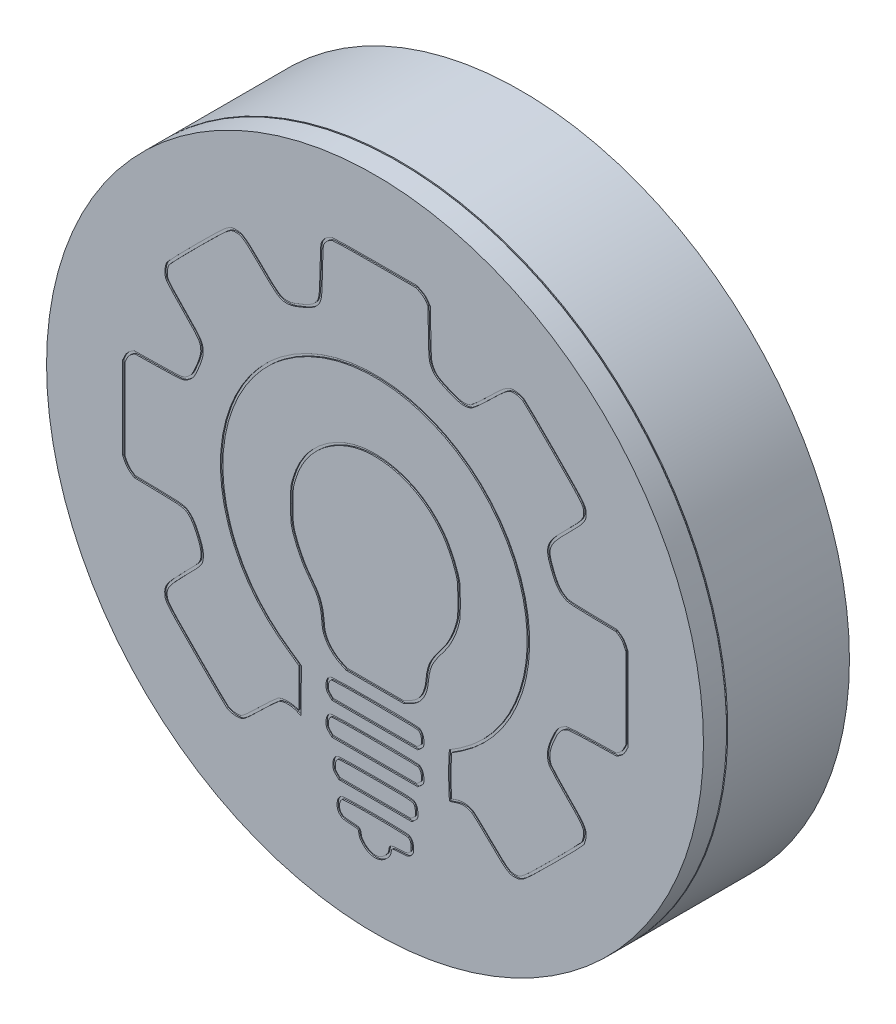
from build123d import *

# Parameters (mm, degrees)
SKETCH1_R           = 27
SKETCH1_R_2         = 25.025
BOSS_EXTRUDE1_DEPTH = 10
SKETCH2_R           = 27
BOSS_EXTRUDE3_DEPTH = 2
CUT_EXTRUDE1_DEPTH  = 0.1
CUT_EXTRUDE2_START  = -10
SKETCH5_R           = 27
SKETCH5_R_2         = 26.9
CUT_EXTRUDE2_DEPTH  = 0.1


with BuildPart() as part:
    # Sketch1 → Boss-Extrude1 (new body)
    with BuildSketch(Plane.XY):
        Circle(SKETCH1_R)
        Circle(SKETCH1_R_2, mode=Mode.SUBTRACT)
    extrude(amount=BOSS_EXTRUDE1_DEPTH)

    # Sketch2 → Boss-Extrude3 (add)
    with BuildSketch(Plane.XY.offset(10)):
        Circle(SKETCH2_R)
    extrude(amount=BOSS_EXTRUDE3_DEPTH)

    # Sketch4 → Cut-Extrude1 (cut)
    # profile 1 of 6: a face of its own
    with BuildSketch(Plane.XY.offset(12)):
        with BuildLine():
            Line((-17.8576224, 4.620282801), (-19.804957, 4.585005001))
            Line((-19.804957, 4.585005001), (-20.1012904, 4.387449401))
            add(Edge.make_bspline(
                [(-20.1012904, 4.387449401), (-20.3059016, 4.246338201), (-20.4540684, 4.077004601), (-20.574013, 3.823004601)],
                knots=[0, 0, 0, 0, 1, 1, 1, 1], degree=3))
            Line((-20.574013, 3.823004601), (-20.7433464, 3.456115401))
            Line((-20.7433464, 3.456115401), (-20.7433464, 0.062391001))
            Line((-20.7433464, 0.062391001), (-20.7433464, -3.324277799))
            Line((-20.7433464, -3.324277799), (-20.5669574, -3.684111399))
            add(Edge.make_bspline(
                [(-20.5669574, -3.684111399), (-20.4540684, -3.909889199), (-20.2776794, -4.121555999), (-20.0942348, -4.241500599)],
                knots=[0, 0, 0, 0, 1, 1, 1, 1], degree=3))
            Line((-20.0942348, -4.241500599), (-19.804957, -4.446111799))
            Line((-19.804957, -4.446111799), (-17.8576224, -4.481389599))
            add(Edge.make_bspline(
                [(-17.8576224, -4.481389599), (-15.6562876, -4.523722999), (-15.585732, -4.537833999), (-15.1412318, -5.052889999)],
                knots=[0, 0, 0, 0, 1, 1, 1, 1], degree=3))
            add(Edge.make_bspline(
                [(-15.1412318, -5.052889999), (-14.8590094, -5.384501199), (-14.4215646, -6.344057399), (-14.3298424, -6.859113399)],
                knots=[0, 0, 0, 0, 1, 1, 1, 1], degree=3))
            add(Edge.make_bspline(
                [(-14.3298424, -6.859113399), (-14.2945646, -7.035502399), (-14.3016202, -7.303613599), (-14.336898, -7.501169199)],
                knots=[0, 0, 0, 0, 1, 1, 1, 1], degree=3))
            add(Edge.make_bspline(
                [(-14.336898, -7.501169199), (-14.4074536, -7.804558399), (-14.513287, -7.938613999), (-15.7056766, -9.138059199)],
                knots=[0, 0, 0, 0, 1, 1, 1, 1], degree=3))
            add(Edge.make_bspline(
                [(-15.7056766, -9.138059199), (-17.0391774, -10.485671199), (-17.2790664, -10.824337999), (-17.286122, -11.318227199)],
                knots=[0, 0, 0, 0, 1, 1, 1, 1], degree=3))
            add(Edge.make_bspline(
                [(-17.286122, -11.318227199), (-17.286122, -11.960283199), (-17.2578998, -11.995560999), (-14.753176, -14.521451399)],
                knots=[0, 0, 0, 0, 1, 1, 1, 1], degree=3))
            add(Edge.make_bspline(
                [(-14.753176, -14.521451399), (-13.4478974, -15.833785599), (-12.28373, -16.969730799), (-12.1567298, -17.047341999)],
                knots=[0, 0, 0, 0, 1, 1, 1, 1], degree=3))
            add(Edge.make_bspline(
                [(-12.1567298, -17.047341999), (-11.8603964, -17.230786599), (-11.3100626, -17.294286599), (-10.9643402, -17.181397599)],
                knots=[0, 0, 0, 0, 1, 1, 1, 1], degree=3))
            add(Edge.make_bspline(
                [(-10.9643402, -17.181397599), (-10.759729, -17.117897599), (-10.357562, -16.765119599), (-9.3838948, -15.805563399)],
                knots=[0, 0, 0, 0, 1, 1, 1, 1], degree=3))
            add(Edge.make_bspline(
                [(-9.3838948, -15.805563399), (-8.6642276, -15.100007399), (-7.9657272, -14.457951399), (-7.8316716, -14.387395799)],
                knots=[0, 0, 0, 0, 1, 1, 1, 1], degree=3))
            add(Edge.make_bspline(
                [(-7.8316716, -14.387395799), (-7.4859492, -14.203951199), (-6.829782, -14.218062399), (-6.399393, -14.408562599)],
                knots=[0, 0, 0, 0, 1, 1, 1, 1], degree=3))
            Line((-6.399393, -14.408562599), (-6.0677816, -14.563784799))
            Line((-6.0677816, -14.563784799), (-6.0677816, -12.799894799))
            add(Edge.make_bspline(
                [(-6.0677816, -12.799894799), (-6.0677816, -11.833283199), (-6.060726, -11.021893799), (-6.0536704, -10.986615999)],
                knots=[0, 0, 0, 0, 1, 1, 1, 1], degree=3))
            add(Edge.make_bspline(
                [(-6.0536704, -10.986615999), (-6.0536704, -10.958393599), (-6.413504, -10.690282399), (-6.8650598, -10.386893399)],
                knots=[0, 0, 0, 0, 1, 1, 1, 1], degree=3))
            add(Edge.make_bspline(
                [(-6.8650598, -10.386893399), (-9.3133392, -8.750003399), (-10.9784514, -6.576890999), (-11.881563, -3.839333599)],
                knots=[0, 0, 0, 0, 1, 1, 1, 1], degree=3))
            add(Edge.make_bspline(
                [(-11.881563, -3.839333599), (-13.5607864, 1.219502801), (-11.7968964, 6.863950801), (-7.5423936, 10.067175201)],
                knots=[0, 0, 0, 0, 1, 1, 1, 1], degree=3))
            add(Edge.make_bspline(
                [(-7.5423936, 10.067175201), (-3.3796132, 13.192788201), (2.2366126, 13.432677201), (6.6675042, 10.666897801)],
                knots=[0, 0, 0, 0, 1, 1, 1, 1], degree=3))
            add(Edge.make_bspline(
                [(6.6675042, 10.666897801), (11.5005628, 7.654173601), (13.6807308, 1.621669801), (11.8886186, -3.811111399)],
                knots=[0, 0, 0, 0, 1, 1, 1, 1], degree=3))
            add(Edge.make_bspline(
                [(11.8886186, -3.811111399), (11.0066736, -6.506335399), (9.299228, -8.757058999), (6.942671, -10.337504399)],
                knots=[0, 0, 0, 0, 1, 1, 1, 1], degree=3))
            add(Edge.make_bspline(
                [(6.942671, -10.337504399), (6.5475596, -10.598560199), (6.1947816, -10.824337999), (6.1453928, -10.838449199)],
                knots=[0, 0, 0, 0, 1, 1, 1, 1], degree=3))
            add(Edge.make_bspline(
                [(6.1453928, -10.838449199), (6.0183926, -10.880782599), (6.0254482, -14.542618199), (6.1524484, -14.521451399)],
                knots=[0, 0, 0, 0, 1, 1, 1, 1], degree=3))
            add(Edge.make_bspline(
                [(6.1524484, -14.521451399), (6.2018372, -14.514395999), (6.4346708, -14.436784799), (6.6675042, -14.359173599)],
                knots=[0, 0, 0, 0, 1, 1, 1, 1], degree=3))
            add(Edge.make_bspline(
                [(6.6675042, -14.359173599), (7.1261156, -14.189840199), (7.5423936, -14.211006799), (7.937505, -14.408562599)],
                knots=[0, 0, 0, 0, 1, 1, 1, 1], degree=3))
            add(Edge.make_bspline(
                [(7.937505, -14.408562599), (8.050394, -14.472062599), (8.7206722, -15.085896199), (9.4191726, -15.777341199)],
                knots=[0, 0, 0, 0, 1, 1, 1, 1], degree=3))
            add(Edge.make_bspline(
                [(9.4191726, -15.777341199), (10.7032846, -17.047341999), (10.985507, -17.251953199), (11.4370628, -17.251953199)],
                knots=[0, 0, 0, 0, 1, 1, 1, 1], degree=3))
            add(Edge.make_bspline(
                [(11.4370628, -17.251953199), (12.0650076, -17.251953199), (12.1143966, -17.216675399), (14.6261758, -14.719007199)],
                knots=[0, 0, 0, 0, 1, 1, 1, 1], degree=3))
            add(Edge.make_bspline(
                [(14.6261758, -14.719007199), (15.93851, -13.413728599), (17.0744552, -12.249561199), (17.1520664, -12.122560999)],
                knots=[0, 0, 0, 0, 1, 1, 1, 1], degree=3))
            add(Edge.make_bspline(
                [(17.1520664, -12.122560999), (17.2296776, -12.002616599), (17.3072886, -11.741560799), (17.335511, -11.544005199)],
                knots=[0, 0, 0, 0, 1, 1, 1, 1], degree=3))
            add(Edge.make_bspline(
                [(17.335511, -11.544005199), (17.413122, -10.887837999), (17.2720108, -10.676171199), (15.8538434, -9.250948199)],
                knots=[0, 0, 0, 0, 1, 1, 1, 1], degree=3))
            add(Edge.make_bspline(
                [(15.8538434, -9.250948199), (15.105954, -8.503058799), (14.5415092, -7.875113999), (14.4780092, -7.734002799)],
                knots=[0, 0, 0, 0, 1, 1, 1, 1], degree=3))
            add(Edge.make_bspline(
                [(14.4780092, -7.734002799), (14.2945646, -7.296557999), (14.3439534, -6.845002199), (14.640287, -6.104168399)],
                knots=[0, 0, 0, 0, 1, 1, 1, 1], degree=3))
            add(Edge.make_bspline(
                [(14.640287, -6.104168399), (15.0353984, -5.130501199), (15.2470652, -4.855334199), (15.8044544, -4.608389599)],
                knots=[0, 0, 0, 0, 1, 1, 1, 1], degree=3))
            add(Edge.make_bspline(
                [(15.8044544, -4.608389599), (15.9102878, -4.559000799), (16.7287328, -4.509611799), (17.928178, -4.488445199)],
                knots=[0, 0, 0, 0, 1, 1, 1, 1], degree=3))
            Line((17.928178, -4.488445199), (19.8755126, -4.446111799))
            Line((19.8755126, -4.446111799), (20.157735, -4.255611599))
            add(Edge.make_bspline(
                [(20.157735, -4.255611599), (20.3411794, -4.135667199), (20.510513, -3.938111399), (20.6304574, -3.698222399)],
                knots=[0, 0, 0, 0, 1, 1, 1, 1], degree=3))
            Line((20.6304574, -3.698222399), (20.813902, -3.324277799))
            Line((20.813902, -3.324277799), (20.813902, 0.062391001))
            Line((20.813902, 0.062391001), (20.813902, 3.456115401))
            Line((20.813902, 3.456115401), (20.6445686, 3.823004601))
            add(Edge.make_bspline(
                [(20.6445686, 3.823004601), (20.524624, 4.077004601), (20.3764572, 4.246338201), (20.171846, 4.387449401)],
                knots=[0, 0, 0, 0, 1, 1, 1, 1], degree=3))
            Line((20.171846, 4.387449401), (19.8755126, 4.585005001))
            Line((19.8755126, 4.585005001), (17.928178, 4.620282801))
            add(Edge.make_bspline(
                [(17.928178, 4.620282801), (16.0937324, 4.655560601), (15.9667322, 4.669671801), (15.6845098, 4.810783001)],
                knots=[0, 0, 0, 0, 1, 1, 1, 1], degree=3))
            add(Edge.make_bspline(
                [(15.6845098, 4.810783001), (15.2611762, 5.036560801), (15.0142316, 5.382283201), (14.6826204, 6.207783801)],
                knots=[0, 0, 0, 0, 1, 1, 1, 1], degree=3))
            add(Edge.make_bspline(
                [(14.6826204, 6.207783801), (14.1393422, 7.576562401), (14.2310646, 7.830562601), (15.9102878, 9.488619201)],
                knots=[0, 0, 0, 0, 1, 1, 1, 1], degree=3))
            add(Edge.make_bspline(
                [(15.9102878, 9.488619201), (17.1167886, 10.681008801), (17.349622, 10.998509001), (17.3566776, 11.457120401)],
                knots=[0, 0, 0, 0, 1, 1, 1, 1], degree=3))
            add(Edge.make_bspline(
                [(17.3566776, 11.457120401), (17.3566776, 12.099176401), (17.3284554, 12.134454201), (14.8237316, 14.660344601)],
                knots=[0, 0, 0, 0, 1, 1, 1, 1], degree=3))
            add(Edge.make_bspline(
                [(14.8237316, 14.660344601), (13.518453, 15.972678801), (12.3542856, 17.108624001), (12.2272854, 17.186235201)],
                knots=[0, 0, 0, 0, 1, 1, 1, 1], degree=3))
            add(Edge.make_bspline(
                [(12.2272854, 17.186235201), (12.107341, 17.263846401), (11.8462852, 17.341457401), (11.6487296, 17.369679801)],
                knots=[0, 0, 0, 0, 1, 1, 1, 1], degree=3))
            add(Edge.make_bspline(
                [(11.6487296, 17.369679801), (10.9925624, 17.447290801), (10.7667846, 17.306179601), (9.348617, 15.902123201)],
                knots=[0, 0, 0, 0, 1, 1, 1, 1], degree=3))
            add(Edge.make_bspline(
                [(9.348617, 15.902123201), (8.5725054, 15.140122801), (7.9727828, 14.603900201), (7.810505, 14.533344601)],
                knots=[0, 0, 0, 0, 1, 1, 1, 1], degree=3))
            add(Edge.make_bspline(
                [(7.810505, 14.533344601), (7.3801158, 14.356955601), (7.0202822, 14.399289001), (6.1806706, 14.745011401)],
                knots=[0, 0, 0, 0, 1, 1, 1, 1], degree=3))
            add(Edge.make_bspline(
                [(6.1806706, 14.745011401), (5.2563922, 15.126011601), (5.002392, 15.302400601), (4.7907252, 15.746901001)],
                knots=[0, 0, 0, 0, 1, 1, 1, 1], degree=3))
            add(Edge.make_bspline(
                [(4.7907252, 15.746901001), (4.6284474, 16.071456601), (4.6213918, 16.170234601), (4.586114, 17.997624601)],
                knots=[0, 0, 0, 0, 1, 1, 1, 1], degree=3))
            Line((4.586114, 17.997624601), (4.5508362, 19.909681401))
            Line((4.5508362, 19.909681401), (4.360336, 20.191903801))
            add(Edge.make_bspline(
                [(4.360336, 20.191903801), (4.2403916, 20.375348201), (4.0428358, 20.544681801), (3.8029468, 20.664626201)],
                knots=[0, 0, 0, 0, 1, 1, 1, 1], degree=3))
            Line((3.8029468, 20.664626201), (3.4290022, 20.848070801))
            Line((3.4290022, 20.848070801), (0.0423334, 20.841015201))
            add(Edge.make_bspline(
                [(0.0423334, 20.841015201), (-2.166057, 20.841015201), (-3.4290022, 20.812793001), (-3.5630578, 20.763404001)],
                knots=[0, 0, 0, 0, 1, 1, 1, 1], degree=3))
            add(Edge.make_bspline(
                [(-3.5630578, 20.763404001), (-3.8876136, 20.643459601), (-4.1345582, 20.445903801), (-4.3180028, 20.156626001)],
                knots=[0, 0, 0, 0, 1, 1, 1, 1], degree=3))
            add(Edge.make_bspline(
                [(-4.3180028, 20.156626001), (-4.473225, 19.902625801), (-4.4802806, 19.825014601), (-4.5155584, 17.990569001)],
                knots=[0, 0, 0, 0, 1, 1, 1, 1], degree=3))
            add(Edge.make_bspline(
                [(-4.5155584, 17.990569001), (-4.5578918, 15.888012201), (-4.5790584, 15.782178801), (-5.0235588, 15.337678401)],
                knots=[0, 0, 0, 0, 1, 1, 1, 1], degree=3))
            add(Edge.make_bspline(
                [(-5.0235588, 15.337678401), (-5.3128366, 15.041345001), (-6.575782, 14.498066801), (-7.0767266, 14.441622401)],
                knots=[0, 0, 0, 0, 1, 1, 1, 1], degree=3))
            add(Edge.make_bspline(
                [(-7.0767266, 14.441622401), (-7.697616, 14.378122201), (-7.9163384, 14.526289001), (-9.285117, 15.888012201)],
                knots=[0, 0, 0, 0, 1, 1, 1, 1], degree=3))
            add(Edge.make_bspline(
                [(-9.285117, 15.888012201), (-10.5621734, 17.158013001), (-10.8796736, 17.383790801), (-11.3594516, 17.390846401)],
                knots=[0, 0, 0, 0, 1, 1, 1, 1], degree=3))
            add(Edge.make_bspline(
                [(-11.3594516, 17.390846401), (-12.0085632, 17.390846401), (-12.0297298, 17.376735201), (-14.5556202, 14.864956001)],
                knots=[0, 0, 0, 0, 1, 1, 1, 1], degree=3))
            add(Edge.make_bspline(
                [(-14.5556202, 14.864956001), (-15.8679544, 13.552621801), (-17.0038996, 12.388454401), (-17.0815108, 12.261454201)],
                knots=[0, 0, 0, 0, 1, 1, 1, 1], degree=3))
            add(Edge.make_bspline(
                [(-17.0815108, 12.261454201), (-17.2649554, 11.965120801), (-17.3284554, 11.414787001), (-17.2155664, 11.069064601)],
                knots=[0, 0, 0, 0, 1, 1, 1, 1], degree=3))
            add(Edge.make_bspline(
                [(-17.2155664, 11.069064601), (-17.1450108, 10.864453401), (-16.7851772, 10.448175401), (-15.7973988, 9.446285801)],
                knots=[0, 0, 0, 0, 1, 1, 1, 1], degree=3))
            add(Edge.make_bspline(
                [(-15.7973988, 9.446285801), (-14.3933424, 8.021062801), (-14.3227868, 7.915229401), (-14.3227868, 7.252006601)],
                knots=[0, 0, 0, 0, 1, 1, 1, 1], degree=3))
            add(Edge.make_bspline(
                [(-14.3227868, 7.252006601), (-14.3227868, 6.871006401), (-14.8378426, 5.565727801), (-15.1130096, 5.220005401)],
                knots=[0, 0, 0, 0, 1, 1, 1, 1], degree=3))
            add(Edge.make_bspline(
                [(-15.1130096, 5.220005401), (-15.232954, 5.085949801), (-15.458732, 4.895449601), (-15.6139542, 4.810783001)],
                knots=[0, 0, 0, 0, 1, 1, 1, 1], degree=3))
            add(Edge.make_bspline(
                [(-15.6139542, 4.810783001), (-15.8961766, 4.669671801), (-16.0231768, 4.655560601), (-17.8576224, 4.620282801)],
                knots=[0, 0, 0, 0, 1, 1, 1, 1], degree=3))
        make_face()
        with BuildLine():
            Line((-17.853999804, 4.420315488), (-19.742760988, 4.386098924))
            Line((-19.742760988, 4.386098924), (-19.988998471, 4.221940602))
            add(Edge.make_bspline(
                [(-19.988998471, 4.221940602), (-20.031944805, 4.192256832), (-20.116259085, 4.126719412), (-20.219217971, 4.020611115), (-20.309944432, 3.897840015), (-20.368230777, 3.790401494), (-20.393163313, 3.73760325)],
                knots=[0.002322855, 0.002322855, 0.002322855, 0.002322855, 0.251742141, 0.501161428, 0.750580714, 1, 1, 1, 1], degree=3))
            Line((-20.393163313, 3.73760325), (-20.5433464, 3.412188051))
            Line((-20.5433464, 3.412188051), (-20.5433464, 0.062391001))
            Line((-20.5433464, 0.062391001), (-20.5433464, -3.277894705))
            Line((-20.5433464, -3.277894705), (-20.388071993, -3.594668616))
            add(Edge.make_bspline(
                [(-20.388071993, -3.594668616), (-20.36300028, -3.644811999), (-20.306692463, -3.741726783), (-20.204944513, -3.87808915), (-20.091758875, -3.995251995), (-20.02105145, -4.050393939), (-19.981725799, -4.076106876)],
                knots=[0, 0, 0, 0, 0.251389654, 0.502779308, 0.754168962, 1.005558616, 1.005558616, 1.005558616, 1.005558616], degree=3))
            Line((-19.981725799, -4.076106876), (-19.73975041, -4.247260262))
            Line((-19.73975041, -4.247260262), (-17.853999882, -4.281422284))
            add(Edge.make_bspline(
                [(-17.853999882, -4.281422284), (-17.724361492, -4.283915332), (-17.453819989, -4.28921633), (-17.002896567, -4.299435132), (-16.534034814, -4.314630288), (-16.110990122, -4.343193124), (-15.680895353, -4.404039237), (-15.304018058, -4.560937294), (-15.092512889, -4.803227299), (-14.989370443, -4.922741611)],
                knots=[-3.3757e-05, -3.3757e-05, -3.3757e-05, -3.3757e-05, 0.062489449, 0.125012655, 0.250059066, 0.375105477, 0.500151889, 0.750244711, 1.000337534, 1.000337534, 1.000337534, 1.000337534], degree=3))
            add(Edge.make_bspline(
                [(-14.989370443, -4.922741611), (-14.943565969, -4.976561849), (-14.865228651, -5.084425358), (-14.691415251, -5.369134945), (-14.477300316, -5.794339099), (-14.25237379, -6.357143527), (-14.162826339, -6.657345704), (-14.133303292, -6.822016799)],
                knots=[-0.000527359, -0.000527359, -0.000527359, -0.000527359, 0.124392901, 0.249313161, 0.499153681, 0.748994201, 0.998834721, 0.998834721, 0.998834721, 0.998834721], degree=3))
            add(Edge.make_bspline(
                [(-14.133303292, -6.822016799), (-14.122010333, -6.87911225), (-14.108769219, -6.992419568), (-14.104515176, -7.179293924), (-14.115219055, -7.368648653), (-14.130535539, -7.483256449), (-14.140923069, -7.541426597)],
                knots=[0.003225677, 0.003225677, 0.003225677, 0.003225677, 0.254570237, 0.505914798, 0.757259358, 1.008603918, 1.008603918, 1.008603918, 1.008603918], degree=3))
            add(Edge.make_bspline(
                [(-14.140923069, -7.541426597), (-14.161930305, -7.631757747), (-14.212209282, -7.797171483), (-14.379265265, -8.037861162), (-14.605823018, -8.295371401), (-14.838349455, -8.542364551), (-15.097406128, -8.807985278), (-15.345366016, -9.05907912), (-15.492798022, -9.207601592), (-15.563675457, -9.278898571)],
                knots=[-0.005543247, -0.005543247, -0.005543247, -0.005543247, 0.245831167, 0.497205581, 0.622892788, 0.748579995, 0.874267202, 0.937110805, 0.999954408, 0.999954408, 0.999954408, 0.999954408], degree=3))
            add(Edge.make_bspline(
                [(-15.563675457, -9.278898571), (-15.642675197, -9.358734757), (-15.806006643, -9.524544971), (-16.085236301, -9.811778374), (-16.380711098, -10.124429668), (-16.648528199, -10.427212796), (-16.906197943, -10.755083667), (-17.059930803, -11.036057514), (-17.084600877, -11.220338725), (-17.086121949, -11.319701537)],
                knots=[4.0741e-05, 4.0741e-05, 4.0741e-05, 4.0741e-05, 0.062471231, 0.124901721, 0.249762701, 0.374623681, 0.499484661, 0.74920662, 0.99892858, 0.99892858, 0.99892858, 0.99892858], degree=3))
            add(Edge.make_bspline(
                [(-17.086121949, -11.319701537), (-17.086117231, -11.386745649), (-17.084413907, -11.535532863), (-17.059236366, -11.670071993), (-16.987890391, -11.835250623), (-16.822265487, -12.073416255), (-16.531181, -12.412380745), (-16.091097528, -12.879671258), (-15.572807314, -13.40925747), (-15.065405262, -13.922489815), (-14.75822922, -14.232315132), (-14.611267357, -14.380518933)],
                knots=[0.000773296, 0.000773296, 0.000773296, 0.000773296, 0.125674862, 0.250576429, 0.375477995, 0.500379561, 0.625281128, 0.750182694, 0.87508426, 0.937535043, 0.999985827, 0.999985827, 0.999985827, 0.999985827], degree=3))
            add(Edge.make_bspline(
                [(-14.611267357, -14.380518933), (-14.306717222, -14.686714855), (-13.666692614, -15.326098179), (-13.006589843, -15.975708319), (-12.575900628, -16.393082636), (-12.314904262, -16.641501084), (-12.160719843, -16.784223679), (-12.073986415, -16.859392789), (-12.061051316, -16.870198486), (-12.050135025, -16.878106022)],
                knots=[2.7251e-05, 2.7251e-05, 2.7251e-05, 2.7251e-05, 0.244110931, 0.488194611, 0.610236451, 0.732278291, 0.854320131, 0.915341051, 0.976361971, 0.976361971, 0.976361971, 0.976361971], degree=3))
            add(Edge.make_bspline(
                [(-12.050135025, -16.878106022), (-11.983367151, -16.919189423), (-11.849376241, -16.974046867), (-11.555974492, -17.036665757), (-11.254124432, -17.041223723), (-11.102796832, -17.016215711), (-11.025023577, -16.990820351)],
                knots=[0.002002929, 0.002002929, 0.002002929, 0.002002929, 0.251838933, 0.501674936, 0.75151094, 1.001346943, 1.001346943, 1.001346943, 1.001346943], degree=3))
            add(Edge.make_bspline(
                [(-11.025023577, -16.990820351), (-11.007260856, -16.985307785), (-10.98408744, -16.975239279), (-10.857298262, -16.898555205), (-10.622517653, -16.710432005), (-10.252930555, -16.370925917), (-9.875387641, -16.007760256), (-9.636674156, -15.773878692), (-9.524094851, -15.662930957)],
                knots=[-0.002286545, -0.002286545, -0.002286545, -0.002286545, 0.123007203, 0.248300951, 0.498888447, 0.749475942, 0.87476969, 1.000063438, 1.000063438, 1.000063438, 1.000063438], degree=3))
            add(Edge.make_bspline(
                [(-9.524094851, -15.662930957), (-9.34891405, -15.491185093), (-8.982549844, -15.137313644), (-8.506149411, -14.692285877), (-8.196374542, -14.415856912), (-8.023290845, -14.275051966), (-7.962393965, -14.230241667), (-7.92516459, -14.2105933)],
                knots=[-8.6047e-05, -8.6047e-05, -8.6047e-05, -8.6047e-05, 0.249846695, 0.499779438, 0.749712181, 0.874678553, 0.999644924, 0.999644924, 0.999644924, 0.999644924], degree=3))
            add(Edge.make_bspline(
                [(-7.92516459, -14.2105933), (-7.811299785, -14.150220221), (-7.56742397, -14.076567725), (-7.144579367, -14.044726801), (-6.709059692, -14.091343912), (-6.443745675, -14.170215239), (-6.316515073, -14.226530468)],
                knots=[0.000188654, 0.000188654, 0.000188654, 0.000188654, 0.250514884, 0.500841113, 0.751167343, 1.001493572, 1.001493572, 1.001493572, 1.001493572], degree=3))
            Line((-6.316515073, -14.226530468), (-6.2677816, -14.249341858))
            Line((-6.2677816, -14.249341858), (-6.2677816, -12.799894799))
            add(Edge.make_bspline(
                [(-6.2677816, -12.799894799), (-6.2677816, -12.608473499), (-6.267182992, -12.209786333), (-6.264825426, -11.706826682), (-6.262045632, -11.372930591), (-6.259310913, -11.168973206), (-6.258138498, -11.104254677), (-6.257253653, -11.067243772)],
                knots=[0, 0, 0, 0, 0.206566596, 0.413133192, 0.619699788, 0.722983086, 0.826266384, 0.826266384, 0.826266384, 0.826266384], degree=3))
            add(Edge.make_bspline(
                [(-6.257253653, -11.067243772), (-6.295588272, -11.036072054), (-6.362075568, -10.984982701), (-6.535968972, -10.857292412), (-6.738361702, -10.714718854), (-6.898814391, -10.605165246), (-6.976410537, -10.553029081)],
                knots=[0.277509677, 0.277509677, 0.277509677, 0.277509677, 0.458097373, 0.638685068, 0.819272763, 0.999860458, 0.999860458, 0.999860458, 0.999860458], degree=3))
            add(Edge.make_bspline(
                [(-6.976410537, -10.553029081), (-7.580755516, -10.148958006), (-8.746945247, -9.235362339), (-10.159181577, -7.682029322), (-11.285444171, -5.921439665), (-11.847313247, -4.581511199), (-12.071436928, -3.902166112)],
                knots=[2.5476e-05, 2.5476e-05, 2.5476e-05, 2.5476e-05, 0.250013865, 0.500002254, 0.749990643, 0.999979032, 0.999979032, 0.999979032, 0.999979032], degree=3))
            add(Edge.make_bspline(
                [(-12.071436928, -3.902166112), (-12.282228025, -3.267104681), (-12.603137776, -1.952310757), (-12.813485192, 0.676099754), (-12.317130169, 3.928676141), (-10.875097095, 6.885456928), (-9.207685602, 8.926693482), (-8.196759389, 9.824850469), (-7.662585295, 10.227031304)],
                knots=[1.133e-05, 1.133e-05, 1.133e-05, 1.133e-05, 0.125010941, 0.250010551, 0.500009773, 0.750008995, 0.875008605, 1.000008216, 1.000008216, 1.000008216, 1.000008216], degree=3))
            add(Edge.make_bspline(
                [(-7.662585295, 10.227031304), (-7.140907212, 10.618731956), (-6.027732184, 11.328372908), (-3.682853066, 12.360842936), (-0.555089935, 12.964067685), (2.615418046, 12.627582193), (5.044778987, 11.796710786), (6.218325729, 11.183038292), (6.773355171, 10.836590393)],
                knots=[-8.405e-06, -8.405e-06, -8.405e-06, -8.405e-06, 0.124992167, 0.249992739, 0.499993884, 0.749995028, 0.874995601, 0.999996173, 0.999996173, 0.999996173, 0.999996173], degree=3))
            add(Edge.make_bspline(
                [(6.773355171, 10.836590393), (7.379074432, 10.459006529), (8.534841449, 9.590135935), (10.458198228, 7.544909813), (12.161926063, 4.480563269), (12.809013675, 1.030300858), (12.636804497, -1.779923836), (12.303087842, -3.193040738), (12.078626469, -3.873537882)],
                knots=[3.509e-06, 3.509e-06, 3.509e-06, 3.509e-06, 0.125001358, 0.249999208, 0.499994908, 0.749990608, 0.874988458, 0.999986308, 0.999986308, 0.999986308, 0.999986308], degree=3))
            add(Edge.make_bspline(
                [(12.078626469, -3.873537882), (11.857632096, -4.548855618), (11.300914548, -5.874102573), (10.173959006, -7.64849283), (8.769640765, -9.213114928), (7.643893104, -10.108037585), (7.053497388, -10.503991595)],
                knots=[2.7633e-05, 2.7633e-05, 2.7633e-05, 2.7633e-05, 0.250040962, 0.500054291, 0.75006762, 1.00008095, 1.00008095, 1.00008095, 1.00008095], degree=3))
            add(Edge.make_bspline(
                [(7.053497388, -10.503991595), (6.976767671, -10.554688025), (6.817738761, -10.659153263), (6.610119452, -10.793632721), (6.4284188, -10.908248641), (6.35357326, -10.953864522), (6.309526847, -10.979095707)],
                knots=[-0.000485027, -0.000485027, -0.000485027, -0.000485027, 0.199236321, 0.39895767, 0.598679018, 0.798400367, 0.798400367, 0.798400367, 0.798400367], degree=3))
            add(Edge.make_bspline(
                [(6.309526847, -10.979095707), (6.304484903, -11.013501136), (6.297864558, -11.073245619), (6.282332961, -11.268592478), (6.268020454, -11.580067285), (6.256916456, -12.039553824), (6.252594353, -12.543490524), (6.254802417, -13.056938713), (6.263607468, -13.544737706), (6.276046367, -13.896683964), (6.289574452, -14.133822393), (6.296315324, -14.221911391), (6.300776244, -14.269672652)],
                knots=[0.098871727, 0.098871727, 0.098871727, 0.098871727, 0.145400216, 0.191928704, 0.284985681, 0.378042658, 0.471099635, 0.564156612, 0.657213589, 0.750270566, 0.796799054, 0.843327543, 0.843327543, 0.843327543, 0.843327543], degree=3))
            add(Edge.make_bspline(
                [(6.300776244, -14.269672652), (6.323730382, -14.262260648), (6.368168038, -14.247775583), (6.443317561, -14.222994561), (6.521147302, -14.197139202), (6.574720233, -14.179283066), (6.601293531, -14.170425311)],
                knots=[0.53687387, 0.53687387, 0.53687387, 0.53687387, 0.651594126, 0.766314383, 0.88103464, 0.995754896, 0.995754896, 0.995754896, 0.995754896], degree=3))
            add(Edge.make_bspline(
                [(6.601293531, -14.170425311), (6.721997746, -14.126045506), (6.977004884, -14.056174175), (7.340192232, -14.033813385), (7.694989339, -14.088393432), (7.923206699, -14.177806624), (8.031308166, -14.231857385)],
                knots=[0.002040543, 0.002040543, 0.002040543, 0.002040543, 0.252450065, 0.502859588, 0.753269111, 1.003678634, 1.003678634, 1.003678634, 1.003678634], degree=3))
            add(Edge.make_bspline(
                [(8.031308166, -14.231857385), (8.062839218, -14.249593584), (8.113272978, -14.286481603), (8.272030692, -14.417854545), (8.565831182, -14.681509669), (9.027797979, -15.114864482), (9.388327402, -15.46539006), (9.559842329, -15.635172182)],
                knots=[-0.012546272, -0.012546272, -0.012546272, -0.012546272, 0.114020115, 0.240586502, 0.493719276, 0.74685205, 0.999984824, 0.999984824, 0.999984824, 0.999984824], degree=3))
            add(Edge.make_bspline(
                [(9.559842329, -15.635172182), (9.635905201, -15.71039912), (9.794000102, -15.866174495), (10.066204006, -16.131336057), (10.360390933, -16.410689756), (10.64165543, -16.661597525), (10.942078751, -16.899841769), (11.186939305, -17.033981479), (11.349902793, -17.051953199), (11.4370628, -17.051953199)],
                knots=[8.288e-06, 8.288e-06, 8.288e-06, 8.288e-06, 0.06250777, 0.125007252, 0.250006216, 0.37500518, 0.500004144, 0.750002072, 1, 1, 1, 1], degree=3))
            add(Edge.make_bspline(
                [(11.4370628, -17.051953199), (11.50267455, -17.051953199), (11.648075245, -17.0500928), (11.780631092, -17.024725746), (11.945732601, -16.952674332), (12.184143919, -16.786246275), (12.523141911, -16.49474989), (12.989854211, -16.054724067), (13.517967595, -15.53701988), (14.029247945, -15.030423973), (14.33762518, -14.723887424), (14.485144757, -14.577196604)],
                knots=[0, 0, 0, 0, 0.124999857, 0.249999714, 0.374999571, 0.499999428, 0.624999286, 0.749999143, 0.874999, 0.937498928, 0.999998857, 0.999998857, 0.999998857, 0.999998857], degree=3))
            add(Edge.make_bspline(
                [(14.485144757, -14.577196604), (14.791167198, -14.272819419), (15.430159352, -13.633189568), (16.079519094, -12.973353485), (16.496870279, -12.542704286), (16.745379643, -12.281635793), (16.888305671, -12.127252362), (16.963692831, -12.040329204), (16.97473847, -12.027104489), (16.982754811, -12.016070451)],
                knots=[2.189e-06, 2.189e-06, 2.189e-06, 2.189e-06, 0.243935921, 0.487869654, 0.60983652, 0.731803386, 0.853770253, 0.914753686, 0.975737119, 0.975737119, 0.975737119, 0.975737119], degree=3))
            add(Edge.make_bspline(
                [(16.982754811, -12.016070451), (16.999307734, -11.990488851), (17.020818945, -11.946558294), (17.07224806, -11.808276837), (17.112550125, -11.656352818), (17.130338666, -11.565371006), (17.137184993, -11.51805853)],
                knots=[-0.006009844, -0.006009844, -0.006009844, -0.006009844, 0.244357075, 0.494723995, 0.745090914, 0.995457833, 0.995457833, 0.995457833, 0.995457833], degree=3))
            add(Edge.make_bspline(
                [(17.137184993, -11.51805853), (17.145244198, -11.449533103), (17.157561732, -11.300371094), (17.140308128, -11.092037191), (17.057787791, -10.881234729), (16.824929897, -10.565461507), (16.563250345, -10.266259666), (16.261070727, -9.948696001), (15.969450025, -9.651222964), (15.795822695, -9.47618635), (15.712246277, -9.392193787)],
                knots=[0.001314798, 0.001314798, 0.001314798, 0.001314798, 0.126145306, 0.250975815, 0.500636831, 0.62546734, 0.750297848, 0.875128356, 0.93754361, 0.999958864, 0.999958864, 0.999958864, 0.999958864], degree=3))
            add(Edge.make_bspline(
                [(15.712246277, -9.392193787), (15.534601583, -9.214546742), (15.162997536, -8.834409106), (14.737624978, -8.379479592), (14.427424785, -8.014815704), (14.333324236, -7.899852092), (14.294567138, -7.813725153)],
                knots=[7.7923e-05, 7.7923e-05, 7.7923e-05, 7.7923e-05, 0.251446555, 0.502815186, 0.754183817, 1.005552449, 1.005552449, 1.005552449, 1.005552449], degree=3))
            add(Edge.make_bspline(
                [(14.294567138, -7.813725153), (14.243109575, -7.69101866), (14.168668129, -7.43472024), (14.164739087, -7.018466239), (14.25307708, -6.575468546), (14.385762932, -6.201962042), (14.454776899, -6.029427171)],
                knots=[-0.001811289, -0.001811289, -0.001811289, -0.001811289, 0.248693623, 0.499198534, 0.749703446, 1.000208358, 1.000208358, 1.000208358, 1.000208358], degree=3))
            add(Edge.make_bspline(
                [(14.454776899, -6.029427171), (14.500910205, -5.915741544), (14.600931345, -5.67700176), (14.775036469, -5.305398982), (14.99483908, -4.93950492), (15.308080995, -4.633552426), (15.583487019, -4.487600122), (15.722213463, -4.426076321)],
                knots=[-0.000158215, -0.000158215, -0.000158215, -0.000158215, 0.124774888, 0.24970799, 0.499574195, 0.7494404, 0.999306605, 0.999306605, 0.999306605, 0.999306605], degree=3))
            add(Edge.make_bspline(
                [(15.722213463, -4.426076321), (15.805856454, -4.388008894), (15.952503552, -4.376745361), (16.41364973, -4.335814232), (16.962544812, -4.312924091), (17.482685328, -4.297339838), (17.779864616, -4.291033251), (17.923831167, -4.288490774)],
                knots=[0.001884785, 0.001884785, 0.001884785, 0.001884785, 0.251356938, 0.50082909, 0.750301242, 0.875037318, 0.999773395, 0.999773395, 0.999773395, 0.999773395], degree=3))
            Line((17.923831167, -4.288490774), (19.812365803, -4.247437303))
            Line((19.812365803, -4.247437303), (20.047056808, -4.089020808))
            add(Edge.make_bspline(
                [(20.047056808, -4.089020808), (20.086061054, -4.063518035), (20.157238769, -4.008518125), (20.266766721, -3.896260395), (20.366246818, -3.763662446), (20.4255524, -3.660818846), (20.451571932, -3.608779739)],
                knots=[-0.002231974, -0.002231974, -0.002231974, -0.002231974, 0.248326019, 0.498884013, 0.749442006, 1, 1, 1, 1], degree=3))
            Line((20.451571932, -3.608779739), (20.613902, -3.277863253))
            Line((20.613902, -3.277863253), (20.613902, 0.062391001))
            Line((20.613902, 0.062391001), (20.613902, 3.412188051))
            Line((20.613902, 3.412188051), (20.463718913, 3.73760325))
            add(Edge.make_bspline(
                [(20.463718913, 3.73760325), (20.438786377, 3.790401494), (20.380500032, 3.897840015), (20.289773571, 4.020611115), (20.186814685, 4.126719412), (20.102500405, 4.192256832), (20.059554071, 4.221940602)],
                knots=[0, 0, 0, 0, 0.249419286, 0.498838572, 0.748257859, 0.997677145, 0.997677145, 0.997677145, 0.997677145], degree=3))
            Line((20.059554071, 4.221940602), (19.813316588, 4.386098924))
            Line((19.813316588, 4.386098924), (17.924332557, 4.420319773))
            add(Edge.make_bspline(
                [(17.924332557, 4.420319773), (17.815836006, 4.422406245), (17.589677432, 4.426846952), (17.210709808, 4.434908175), (16.815184303, 4.444993319), (16.458846479, 4.458662354), (16.105637991, 4.481389285), (15.822287317, 4.526325909), (15.672554322, 4.593153943), (15.592713752, 4.633074227)],
                knots=[0, 0, 0, 0, 0.06267372, 0.12534744, 0.25069488, 0.37604232, 0.50138976, 0.75208464, 1.00277952, 1.00277952, 1.00277952, 1.00277952], degree=3))
            add(Edge.make_bspline(
                [(15.592713752, 4.633074227), (15.476242309, 4.695192297), (15.256568375, 4.842005172), (14.982042054, 5.148957543), (14.780365968, 5.493416667), (14.62239964, 5.829677081), (14.536598624, 6.034743193), (14.496880264, 6.133616601)],
                knots=[-0.001827999, -0.001827999, -0.001827999, -0.001827999, 0.248667796, 0.499163591, 0.749659387, 0.874907284, 1.000155182, 1.000155182, 1.000155182, 1.000155182], degree=3))
            add(Edge.make_bspline(
                [(14.496880264, 6.133616601), (14.434271542, 6.29135803), (14.306640708, 6.628041771), (14.198554739, 7.032242995), (14.171308473, 7.426867841), (14.256843525, 7.810581593), (14.454832986, 8.187850001), (14.76071539, 8.587445674), (15.117422574, 8.974706572), (15.463609228, 9.32735762), (15.670088008, 9.532512751), (15.769733447, 9.630902285)],
                knots=[-9.3744e-05, -9.3744e-05, -9.3744e-05, -9.3744e-05, 0.124917163, 0.24992807, 0.374938976, 0.499949883, 0.62496079, 0.749971697, 0.874982604, 0.937488057, 0.99999351, 0.99999351, 0.99999351, 0.99999351], degree=3))
            add(Edge.make_bspline(
                [(15.769733447, 9.630902285), (15.905801214, 9.765378785), (16.196157466, 10.055051169), (16.508529571, 10.379165548), (16.755342539, 10.652512117), (16.990194229, 10.946443844), (17.131875332, 11.201067917), (17.155175118, 11.368429236), (17.15667754, 11.458715281)],
                knots=[9.054e-06, 9.054e-06, 9.054e-06, 9.054e-06, 0.12485043, 0.249691806, 0.374533181, 0.499374557, 0.749057309, 0.99874006, 0.99874006, 0.99874006, 0.99874006], degree=3))
            add(Edge.make_bspline(
                [(17.15667754, 11.458715281), (17.156672423, 11.525744289), (17.154963431, 11.674494252), (17.129775564, 11.809018619), (17.05840864, 11.974207727), (16.892761593, 12.212383574), (16.601664739, 12.551352312), (16.161582763, 13.018636959), (15.643310149, 13.548204163), (15.135933056, 14.061411065), (14.828776095, 14.371217134), (14.681822957, 14.519412135)],
                knots=[0.000836593, 0.000836593, 0.000836593, 0.000836593, 0.125730247, 0.250623901, 0.375517556, 0.50041121, 0.625304864, 0.750198518, 0.875092172, 0.937538999, 0.999985827, 0.999985827, 0.999985827, 0.999985827], degree=3))
            add(Edge.make_bspline(
                [(14.681822957, 14.519412135), (14.377456188, 14.825423701), (13.737847178, 15.464394299), (13.078037916, 16.11372693), (12.647406612, 16.531060268), (12.386349226, 16.779558709), (12.231972295, 16.922478462), (12.145052693, 16.997862384), (12.131828453, 17.008907589), (12.120794852, 17.016923612)],
                knots=[2.7251e-05, 2.7251e-05, 2.7251e-05, 2.7251e-05, 0.243954718, 0.487882185, 0.609845919, 0.731809652, 0.853773386, 0.914755252, 0.975737119, 0.975737119, 0.975737119, 0.975737119], degree=3))
            add(Edge.make_bspline(
                [(12.120794852, 17.016923612), (12.095213272, 17.033476522), (12.051282752, 17.05498772), (11.913001413, 17.106416803), (11.761077506, 17.146718858), (11.670095708, 17.164507412), (11.622783248, 17.171353749)],
                knots=[-0.006009844, -0.006009844, -0.006009844, -0.006009844, 0.244356922, 0.494723688, 0.745090454, 0.995457221, 0.995457221, 0.995457221, 0.995457221], degree=3))
            add(Edge.make_bspline(
                [(11.622783248, 17.171353749), (11.554028485, 17.179439453), (11.404789049, 17.19173647), (11.193216029, 17.174628074), (10.978753089, 17.092104488), (10.660912152, 16.861400686), (10.360841436, 16.602271845), (10.043487377, 16.303084026), (9.746868496, 16.014333505), (9.572635635, 15.842473738), (9.489032859, 15.759702835)],
                knots=[0.001315285, 0.001315285, 0.001315285, 0.001315285, 0.126159589, 0.251003894, 0.500692503, 0.625536807, 0.750381112, 0.875225416, 0.937647569, 1.000069721, 1.000069721, 1.000069721, 1.000069721], degree=3))
            add(Edge.make_bspline(
                [(9.489032859, 15.759702835), (9.307356535, 15.581329735), (8.917023575, 15.205156865), (8.464363541, 14.787307992), (8.101290493, 14.483596599), (7.977318838, 14.387786529), (7.888308684, 14.349086442)],
                knots=[-0.000127924, -0.000127924, -0.000127924, -0.000127924, 0.250901098, 0.50193012, 0.752959142, 1.003988164, 1.003988164, 1.003988164, 1.003988164], degree=3))
            add(Edge.make_bspline(
                [(7.888308684, 14.349086442), (7.771062782, 14.301034848), (7.526894235, 14.227308747), (7.134367902, 14.226879384), (6.760321602, 14.316304076), (6.41390043, 14.436039032), (6.203941691, 14.519137704), (6.10448515, 14.560090395)],
                knots=[-0.001517236, -0.001517236, -0.001517236, -0.001517236, 0.248865596, 0.499248427, 0.749631259, 0.874822675, 1.000014091, 1.000014091, 1.000014091, 1.000014091], degree=3))
            add(Edge.make_bspline(
                [(6.10448515, 14.560090395), (5.997235272, 14.604300261), (5.771237136, 14.699699563), (5.422148465, 14.860776485), (5.082411826, 15.053333668), (4.797091019, 15.318267325), (4.666303117, 15.543227636), (4.610989383, 15.659159795)],
                knots=[-1.2798e-05, -1.2798e-05, -1.2798e-05, -1.2798e-05, 0.124837068, 0.249686934, 0.499386666, 0.749086398, 0.99878613, 0.99878613, 0.99878613, 0.99878613], degree=3))
            add(Edge.make_bspline(
                [(4.610989383, 15.659159795), (4.568266602, 15.744681852), (4.493420846, 15.908335121), (4.445897282, 16.194720845), (4.423076355, 16.544863521), (4.409910479, 16.896582927), (4.400354543, 17.287291136), (4.392591317, 17.662231128), (4.388223406, 17.886427044), (4.386147959, 17.993935191)],
                knots=[0.001683746, 0.001683746, 0.001683746, 0.001683746, 0.251270602, 0.500857457, 0.625650885, 0.750444313, 0.875237741, 0.937634455, 1.000031169, 1.000031169, 1.000031169, 1.000031169], degree=3))
            Line((4.386147959, 17.993935191), (4.351961767, 19.846830807))
            Line((4.351961767, 19.846830807), (4.193745209, 20.081225609))
            add(Edge.make_bspline(
                [(4.193745209, 20.081225609), (4.168242436, 20.120229855), (4.113242526, 20.19140757), (4.000984797, 20.300935522), (3.868386847, 20.40041562), (3.765543247, 20.459721201), (3.713504141, 20.485740733)],
                knots=[-0.002231974, -0.002231974, -0.002231974, -0.002231974, 0.248326019, 0.498884013, 0.749442006, 1, 1, 1, 1], degree=3))
            Line((3.713504141, 20.485740733), (3.382784816, 20.64797408))
            Line((3.382784816, 20.64797408), (0.0423334, 20.641015201))
            add(Edge.make_bspline(
                [(0.0423334, 20.641015201), (-0.208070789, 20.641015201), (-0.728925505, 20.640209631), (-1.610256584, 20.63544926), (-2.515251693, 20.623925292), (-3.118537116, 20.604927048), (-3.371538896, 20.589236774), (-3.469964967, 20.578718089), (-3.486917863, 20.576302824), (-3.499249916, 20.573752733)],
                knots=[0, 0, 0, 0, 0.119667121, 0.239334242, 0.478668484, 0.718002726, 0.837669847, 0.897503407, 0.957336968, 0.957336968, 0.957336968, 0.957336968], degree=3))
            add(Edge.make_bspline(
                [(-3.499249916, 20.573752733), (-3.567602425, 20.548204926), (-3.703913988, 20.485688254), (-3.873309557, 20.370590827), (-4.021165295, 20.23014612), (-4.109565844, 20.111714739), (-4.14822685, 20.050894553)],
                knots=[0.006391819, 0.006391819, 0.006391819, 0.006391819, 0.254344445, 0.502297071, 0.750249697, 0.998202323, 0.998202323, 0.998202323, 0.998202323], degree=3))
            add(Edge.make_bspline(
                [(-4.14822685, 20.050894553), (-4.176124893, 20.005194273), (-4.224967596, 19.922145738), (-4.25764498, 19.741818165), (-4.279442613, 19.419781667), (-4.291967906, 19.080437983), (-4.301436744, 18.693364565), (-4.309158432, 18.319162447), (-4.313525961, 18.094332922), (-4.315597108, 17.986633262)],
                knots=[0.002001174, 0.002001174, 0.002001174, 0.002001174, 0.251504982, 0.501008791, 0.625760695, 0.750512599, 0.875264503, 0.937640455, 1.000016408, 1.000016408, 1.000016408, 1.000016408], degree=3))
            add(Edge.make_bspline(
                [(-4.315597108, 17.986633262), (-4.318091357, 17.862752366), (-4.32343972, 17.60445021), (-4.33381628, 17.17222143), (-4.349006466, 16.720759328), (-4.376096048, 16.310180802), (-4.431720249, 15.889960901), (-4.567014382, 15.519635282), (-4.775717978, 15.302699963), (-4.881353751, 15.197040824)],
                knots=[-1.4315e-05, -1.4315e-05, -1.4315e-05, -1.4315e-05, 0.062450562, 0.124915439, 0.249845193, 0.374774946, 0.4997047, 0.749564208, 0.999423716, 0.999423716, 0.999423716, 0.999423716], degree=3))
            add(Edge.make_bspline(
                [(-4.881353751, 15.197040824), (-4.935683268, 15.141594776), (-5.051092103, 15.053109859), (-5.372660382, 14.856116466), (-5.88689754, 14.608041949), (-6.431405273, 14.396962009), (-6.819704769, 14.283476589), (-6.972387779, 14.252113293), (-7.055355069, 14.242764876)],
                knots=[0.000744041, 0.000744041, 0.000744041, 0.000744041, 0.125736038, 0.250728035, 0.500712029, 0.750696022, 0.875688019, 1.000680016, 1.000680016, 1.000680016, 1.000680016], degree=3))
            add(Edge.make_bspline(
                [(-7.055355069, 14.242764876), (-7.212874126, 14.226654935), (-7.532910142, 14.216417108), (-7.919719434, 14.387443146), (-8.267104313, 14.647844537), (-8.573202518, 14.916052831), (-8.886134454, 15.213857467), (-9.175791337, 15.49767816), (-9.34488341, 15.665355876), (-9.426159251, 15.746212752)],
                knots=[-0.000549256, -0.000549256, -0.000549256, -0.000549256, 0.249587255, 0.499723766, 0.624792022, 0.749860277, 0.874928532, 0.93746266, 0.999996788, 0.999996788, 0.999996788, 0.999996788], degree=3))
            add(Edge.make_bspline(
                [(-9.426159251, 15.746212752), (-9.501794182, 15.821429771), (-9.658900081, 15.976967056), (-9.930891728, 16.242711542), (-10.226807587, 16.523715436), (-10.51315169, 16.777996016), (-10.823228325, 17.021979298), (-11.087222668, 17.165992074), (-11.265661413, 17.189344882), (-11.360970861, 17.190846374)],
                knots=[3.451e-06, 3.451e-06, 3.451e-06, 3.451e-06, 0.06243238, 0.12486131, 0.249719168, 0.374577027, 0.499434885, 0.749150602, 0.998866319, 0.998866319, 0.998866319, 0.998866319], degree=3))
            add(Edge.make_bspline(
                [(-11.360970861, 17.190846374), (-11.428963559, 17.190843891), (-11.58024624, 17.189582555), (-11.715022271, 17.165414706), (-11.878076911, 17.096246717), (-12.113880302, 16.933156582), (-12.450502189, 16.644063339), (-12.9156413, 16.205149001), (-13.443901197, 15.686801479), (-13.956476252, 15.178644543), (-14.266253309, 14.870652536), (-14.414396878, 14.723336611)],
                knots=[0.00078452, 0.00078452, 0.00078452, 0.00078452, 0.125683177, 0.250581835, 0.375480493, 0.500379151, 0.625277808, 0.750176466, 0.875075124, 0.937524453, 0.999973782, 0.999973782, 0.999973782, 0.999973782], degree=3))
            add(Edge.make_bspline(
                [(-14.414396878, 14.723336611), (-14.720478924, 14.417253902), (-15.360178773, 13.774201159), (-16.009765915, 13.112496171), (-16.427191729, 12.681063294), (-16.675633799, 12.419774532), (-16.818375008, 12.265487163), (-16.893557519, 12.178717565), (-16.904365098, 12.165779462), (-16.912274443, 12.154860045)],
                knots=[5.034e-05, 5.034e-05, 5.034e-05, 5.034e-05, 0.244130107, 0.488209874, 0.610249757, 0.732289641, 0.854329524, 0.915349466, 0.976369408, 0.976369408, 0.976369408, 0.976369408], degree=3))
            add(Edge.make_bspline(
                [(-16.912274443, 12.154860045), (-16.953190156, 12.08836488), (-17.007892933, 11.954950585), (-17.070535229, 11.662868016), (-17.075486688, 11.361960692), (-17.051163503, 11.210666102), (-17.026028085, 11.132938384)],
                knots=[0.002001996, 0.002001996, 0.002001996, 0.002001996, 0.250939209, 0.499876423, 0.748813636, 0.997750849, 0.997750849, 0.997750849, 0.997750849], degree=3))
            add(Edge.make_bspline(
                [(-17.026028085, 11.132938384), (-17.019105469, 11.113456533), (-17.006343261, 11.087135396), (-16.92262011, 10.954035375), (-16.726938598, 10.711818707), (-16.378692433, 10.332229836), (-16.007236306, 9.945584897), (-15.768355619, 9.701697908), (-15.65495072, 9.586672931)],
                knots=[0.005010377, 0.005010377, 0.005010377, 0.005010377, 0.129385232, 0.253760087, 0.502509797, 0.751259506, 0.875634361, 1.000009216, 1.000009216, 1.000009216, 1.000009216], degree=3))
            add(Edge.make_bspline(
                [(-15.65495072, 9.586672931), (-15.572088724, 9.502561763), (-15.399556712, 9.32716244), (-15.111145804, 9.031625576), (-14.812069824, 8.718202146), (-14.547652764, 8.420184959), (-14.29395204, 8.088641722), (-14.129545372, 7.72523829), (-14.1227868, 7.408059389), (-14.1227868, 7.252006601)],
                knots=[-6.481e-06, -6.481e-06, -6.481e-06, -6.481e-06, 0.062493924, 0.124994329, 0.249995139, 0.374995949, 0.499996759, 0.74999838, 1, 1, 1, 1], degree=3))
            add(Edge.make_bspline(
                [(-14.1227868, 7.252006601), (-14.1227868, 7.177159388), (-14.143479225, 7.039588931), (-14.2336633, 6.680289546), (-14.422541378, 6.142718319), (-14.651859531, 5.613359808), (-14.8346285, 5.270551067), (-14.911984239, 5.151417363), (-14.960116036, 5.090944122)],
                knots=[0, 0, 0, 0, 0.125543797, 0.251087593, 0.502175186, 0.75326278, 0.878806576, 1.004350373, 1.004350373, 1.004350373, 1.004350373], degree=3))
            add(Edge.make_bspline(
                [(-14.960116036, 5.090944122), (-14.998112915, 5.048476992), (-15.07453862, 4.970968418), (-15.22042577, 4.841835217), (-15.374544902, 4.72312032), (-15.46985131, 4.661567032), (-15.52131814, 4.633494233)],
                knots=[-0.010686216, -0.010686216, -0.010686216, -0.010686216, 0.243668044, 0.498022303, 0.752376562, 1.006730822, 1.006730822, 1.006730822, 1.006730822], degree=3))
            add(Edge.make_bspline(
                [(-15.52131814, 4.633494233), (-15.601177581, 4.593564513), (-15.750886583, 4.526530162), (-16.034197966, 4.481471656), (-16.387409451, 4.45870305), (-16.743875538, 4.445014525), (-17.139676507, 4.434918726), (-17.51898555, 4.42684952), (-17.745389788, 4.422404142), (-17.853999804, 4.420315488)],
                knots=[-0.00377166, -0.00377166, -0.00377166, -0.00377166, 0.247181378, 0.498134417, 0.623610936, 0.749087455, 0.874563974, 0.937302233, 1.000040493, 1.000040493, 1.000040493, 1.000040493], degree=3))
        make_face(mode=Mode.SUBTRACT)
    # profile 2 of 6: a face of its own
    with BuildSketch(Plane.XY.offset(12)):
        with BuildLine():
            Line((-2.8363352, -9.229781399), (-2.3636126, -9.455559399))
            Line((-2.3636126, -9.455559399), (0, -9.455559399))
            Line((0, -9.455559399), (2.3636126, -9.455559399))
            Line((2.3636126, -9.455559399), (2.8363352, -9.229781399))
            add(Edge.make_bspline(
                [(2.8363352, -9.229781399), (3.7958912, -8.778225599), (4.282725, -8.037391799), (4.3885584, -6.866168799)],
                knots=[0, 0, 0, 0, 1, 1, 1, 1], degree=3))
            add(Edge.make_bspline(
                [(4.3885584, -6.866168799), (4.4873362, -5.793723799), (4.699003, -5.335112399), (5.6797258, -4.093333799)],
                knots=[0, 0, 0, 0, 1, 1, 1, 1], degree=3))
            add(Edge.make_bspline(
                [(5.6797258, -4.093333799), (6.1453928, -3.500666799), (6.5546152, -2.696332999), (6.815671, -1.835554599)],
                knots=[0, 0, 0, 0, 1, 1, 1, 1], degree=3))
            add(Edge.make_bspline(
                [(6.815671, -1.835554599), (6.9991156, -1.235831999), (7.0132266, -1.122942999), (7.0132266, 0.104724401)],
                knots=[0, 0, 0, 0, 1, 1, 1, 1], degree=3))
            add(Edge.make_bspline(
                [(7.0132266, 0.104724401), (7.0132266, 1.325336201), (6.9991156, 1.452336401), (6.8227266, 2.030892201)],
                knots=[0, 0, 0, 0, 1, 1, 1, 1], degree=3))
            add(Edge.make_bspline(
                [(6.8227266, 2.030892201), (6.589893, 2.785837201), (6.124226, 3.731282201), (5.693837, 4.309838201)],
                knots=[0, 0, 0, 0, 1, 1, 1, 1], degree=3))
            add(Edge.make_bspline(
                [(5.693837, 4.309838201), (4.169836, 6.377117201), (1.5663344, 7.449562401), (-1.0230562, 7.082673201)],
                knots=[0, 0, 0, 0, 1, 1, 1, 1], degree=3))
            add(Edge.make_bspline(
                [(-1.0230562, 7.082673201), (-2.8998352, 6.814562001), (-4.7413364, 5.636283401), (-5.8278926, 4.013504601)],
                knots=[0, 0, 0, 0, 1, 1, 1, 1], degree=3))
            add(Edge.make_bspline(
                [(-5.8278926, 4.013504601), (-6.2653372, 3.350282001), (-6.4911152, 2.870504001), (-6.752171, 2.016781201)],
                knots=[0, 0, 0, 0, 1, 1, 1, 1], degree=3))
            add(Edge.make_bspline(
                [(-6.752171, 2.016781201), (-6.92856, 1.452336401), (-6.942671, 1.318280801), (-6.942671, 0.104724401)],
                knots=[0, 0, 0, 0, 1, 1, 1, 1], degree=3))
            add(Edge.make_bspline(
                [(-6.942671, 0.104724401), (-6.942671, -1.122942999), (-6.92856, -1.242887599), (-6.752171, -1.828498999)],
                knots=[0, 0, 0, 0, 1, 1, 1, 1], degree=3))
            add(Edge.make_bspline(
                [(-6.752171, -1.828498999), (-6.5052264, -2.625777399), (-5.9619482, -3.684111399), (-5.517448, -4.234444999)],
                knots=[0, 0, 0, 0, 1, 1, 1, 1], degree=3))
            add(Edge.make_bspline(
                [(-5.517448, -4.234444999), (-4.6848918, -5.278667799), (-4.473225, -5.758445999), (-4.3815028, -6.859113399)],
                knots=[0, 0, 0, 0, 1, 1, 1, 1], degree=3))
            add(Edge.make_bspline(
                [(-4.3815028, -6.859113399), (-4.3391694, -7.416502599), (-4.282725, -7.663447199), (-4.1345582, -7.966836199)],
                knots=[0, 0, 0, 0, 1, 1, 1, 1], degree=3))
            add(Edge.make_bspline(
                [(-4.1345582, -7.966836199), (-3.8664468, -8.510114399), (-3.40078, -8.961670199), (-2.8363352, -9.229781399)],
                knots=[0, 0, 0, 0, 1, 1, 1, 1], degree=3))
        make_face()
        with BuildLine():
            Line((-2.750331538, -9.04921724), (-2.318302723, -9.255559399))
            Line((-2.318302723, -9.255559399), (0, -9.255559399))
            Line((0, -9.255559399), (2.318302723, -9.255559399))
            Line((2.318302723, -9.255559399), (2.750656895, -9.049061845))
            add(Edge.make_bspline(
                [(2.750656895, -9.049061845), (2.960435854, -8.950342327), (3.376451064, -8.6940474), (3.786676095, -8.231198151), (4.021824946, -7.730461201), (4.139701892, -7.258013335), (4.177270664, -6.982068639), (4.189385516, -6.847997605)],
                knots=[-0.000180254, -0.000180254, -0.000180254, -0.000180254, 0.249877064, 0.499934383, 0.749991701, 0.87502036, 1.000049019, 1.000049019, 1.000049019, 1.000049019], degree=3))
            add(Edge.make_bspline(
                [(4.189385516, -6.847997605), (4.20128609, -6.718791342), (4.231221241, -6.452092046), (4.315284803, -5.992610612), (4.493141537, -5.462020686), (4.815296803, -4.916576727), (5.171681966, -4.419897006), (5.408902673, -4.11355835), (5.52261499, -3.969574932)],
                knots=[-5.3526e-05, -5.3526e-05, -5.3526e-05, -5.3526e-05, 0.124946532, 0.249946591, 0.499946708, 0.749946825, 0.874946883, 0.999946941, 0.999946941, 0.999946941, 0.999946941], degree=3))
            add(Edge.make_bspline(
                [(5.52261499, -3.969574932), (5.639346929, -3.820990814), (5.849715, -3.51921111), (6.152751386, -2.982125691), (6.41519878, -2.400243553), (6.56115876, -1.985636781), (6.624348472, -1.777281561)],
                knots=[0.000114103, 0.000114103, 0.000114103, 0.000114103, 0.250107651, 0.500101199, 0.750094747, 1.000088295, 1.000088295, 1.000088295, 1.000088295], degree=3))
            add(Edge.make_bspline(
                [(6.624348472, -1.777281561), (6.64486423, -1.710210826), (6.688074832, -1.566927402), (6.745563943, -1.350023538), (6.78937224, -1.103539214), (6.807746869, -0.741739004), (6.812784678, -0.327421411), (6.8132266, -0.031966575), (6.8132266, 0.104724401)],
                knots=[-0.000126638, -0.000126638, -0.000126638, -0.000126638, 0.124889192, 0.249905022, 0.499936681, 0.749968341, 0.87498417, 1, 1, 1, 1], degree=3))
            add(Edge.make_bspline(
                [(6.8132266, 0.104724401), (6.8132266, 0.240796691), (6.812784672, 0.53463682), (6.8078616, 0.948743898), (6.790012703, 1.312168807), (6.747706858, 1.557826844), (6.692561183, 1.769542077), (6.651250193, 1.907521083), (6.631514933, 1.972255992)],
                knots=[0, 0, 0, 0, 0.124977402, 0.249954803, 0.499909607, 0.74986441, 0.874841811, 0.999819213, 0.999819213, 0.999819213, 0.999819213], degree=3))
            add(Edge.make_bspline(
                [(6.631514933, 1.972255992), (6.571269325, 2.167556763), (6.435166236, 2.539671159), (6.159749767, 3.153585564), (5.843173678, 3.735526511), (5.646628311, 4.03821445), (5.533110244, 4.190812586)],
                knots=[0.000140302, 0.000140302, 0.000140302, 0.000140302, 0.250155238, 0.500170173, 0.750185108, 1.000200043, 1.000200043, 1.000200043, 1.000200043], degree=3))
            add(Edge.make_bspline(
                [(5.533110244, 4.190812586), (5.168443045, 4.685476856), (4.290732073, 5.578583428), (2.690688448, 6.496929961), (0.89977457, 6.978210162), (-0.376343935, 6.972297512), (-0.994885071, 6.884667138)],
                knots=[-5.6164e-05, -5.6164e-05, -5.6164e-05, -5.6164e-05, 0.24995412, 0.499964404, 0.749974688, 0.999984972, 0.999984972, 0.999984972, 0.999984972], degree=3))
            add(Edge.make_bspline(
                [(-0.994885071, 6.884667138), (-1.454192202, 6.819042541), (-2.350803191, 6.580256773), (-3.638315103, 5.929202468), (-4.779123476, 5.02925164), (-5.396467032, 4.298273028), (-5.661321033, 3.902804986)],
                knots=[2.0792e-05, 2.0792e-05, 2.0792e-05, 2.0792e-05, 0.249985204, 0.499949616, 0.749914028, 0.999878439, 0.999878439, 0.999878439, 0.999878439], degree=3))
            add(Edge.make_bspline(
                [(-5.661321033, 3.902804986), (-5.760815149, 3.751940478), (-5.959987792, 3.433359201), (-6.179925617, 3.006915126), (-6.370319785, 2.550210961), (-6.502709655, 2.148637827), (-6.56109219, 1.957711209)],
                knots=[0.000296618, 0.000296618, 0.000296618, 0.000296618, 0.250279675, 0.500262732, 0.75024579, 1.000228847, 1.000228847, 1.000228847, 1.000228847], degree=3))
            add(Edge.make_bspline(
                [(-6.56109219, 1.957711209), (-6.580851797, 1.894480468), (-6.622099099, 1.759803848), (-6.677128551, 1.551976182), (-6.719414342, 1.308380002), (-6.737301048, 0.945473429), (-6.742228277, 0.532550923), (-6.742671, 0.240173968), (-6.742671, 0.104724401)],
                knots=[-0.000345476, -0.000345476, -0.000345476, -0.000345476, 0.124697709, 0.249740893, 0.499827262, 0.749913631, 0.874956816, 1, 1, 1, 1], degree=3))
            add(Edge.make_bspline(
                [(-6.742671, 0.104724401), (-6.742671, -0.031998789), (-6.742229405, -0.327385812), (-6.73730848, -0.742625991), (-6.719475473, -1.106045902), (-6.677184254, -1.351798819), (-6.621991154, -1.564963741), (-6.580612155, -1.704600591), (-6.560896192, -1.770064668)],
                knots=[0, 0, 0, 0, 0.12494599, 0.24989198, 0.49978396, 0.749675939, 0.874621929, 0.999567919, 0.999567919, 0.999567919, 0.999567919], degree=3))
            add(Edge.make_bspline(
                [(-6.560896192, -1.770064668), (-6.496035199, -1.979355601), (-6.347993271, -2.373260737), (-6.035392409, -3.044107076), (-5.750703629, -3.550323589), (-5.520070636, -3.901675684), (-5.418206805, -4.039014572), (-5.361462469, -4.109269466)],
                knots=[0.000321659, 0.000321659, 0.000321659, 0.000321659, 0.250315728, 0.500309796, 0.750303864, 0.875300898, 1.000297932, 1.000297932, 1.000297932, 1.000297932], degree=3))
            add(Edge.make_bspline(
                [(-5.361462469, -4.109269466), (-5.263492533, -4.232146986), (-5.061469489, -4.492246626), (-4.750398144, -4.932478773), (-4.463380899, -5.442627007), (-4.300299229, -5.969904713), (-4.221413229, -6.436923642), (-4.193161893, -6.71088525), (-4.182132714, -6.843235511)],
                knots=[-0.000157817, -0.000157817, -0.000157817, -0.000157817, 0.12488959, 0.249936997, 0.500031811, 0.750126625, 0.875174032, 1.000221439, 1.000221439, 1.000221439, 1.000221439], degree=3))
            add(Edge.make_bspline(
                [(-4.182132714, -6.843235511), (-4.173113812, -6.961984269), (-4.148764562, -7.222420974), (-4.105077854, -7.471542875), (-4.046785679, -7.676064781), (-3.987240305, -7.812710116), (-3.95502681, -7.878696169)],
                knots=[-0.000437528, -0.000437528, -0.000437528, -0.000437528, 0.249561998, 0.499561524, 0.74956105, 0.999560577, 0.999560577, 0.999560577, 0.999560577], degree=3))
            add(Edge.make_bspline(
                [(-3.95502681, -7.878696169), (-3.893012512, -8.004300621), (-3.746843029, -8.243764218), (-3.465559485, -8.566278874), (-3.132626556, -8.840899113), (-2.880814758, -8.987237729), (-2.750331538, -9.04921724)],
                knots=[0.000246403, 0.000246403, 0.000246403, 0.000246403, 0.250213196, 0.500179989, 0.750146782, 1.000113575, 1.000113575, 1.000113575, 1.000113575], degree=3))
        make_face(mode=Mode.SUBTRACT)
    # profile 3 of 6: a face of its own
    with BuildSketch(Plane.XY.offset(12)):
        with BuildLine():
            Line((-3.7817802, -11.932060999), (-3.5418912, -12.171949999))
            Line((-3.5418912, -12.171949999), (-0.0070556, -12.171949999))
            Line((-0.0070556, -12.171949999), (3.5207244, -12.171949999))
            Line((3.5207244, -12.171949999), (3.7747246, -11.953227599))
            add(Edge.make_bspline(
                [(3.7747246, -11.953227599), (3.993447, -11.755671999), (4.0216692, -11.699227399), (4.0216692, -11.381727199)],
                knots=[0, 0, 0, 0, 1, 1, 1, 1], degree=3))
            add(Edge.make_bspline(
                [(4.0216692, -11.381727199), (4.0216692, -10.965449199), (3.8876136, -10.676171199), (3.6336134, -10.563282399)],
                knots=[0, 0, 0, 0, 1, 1, 1, 1], degree=3))
            add(Edge.make_bspline(
                [(3.6336134, -10.563282399), (3.3866688, -10.450393399), (-3.4290022, -10.443337799), (-3.6336134, -10.563282399)],
                knots=[0, 0, 0, 0, 1, 1, 1, 1], degree=3))
            add(Edge.make_bspline(
                [(-3.6336134, -10.563282399), (-3.9087802, -10.711448999), (-4.0216692, -10.923115799), (-4.0216692, -11.311171599)],
                knots=[0, 0, 0, 0, 1, 1, 1, 1], degree=3))
            add(Edge.make_bspline(
                [(-4.0216692, -11.311171599), (-4.0216692, -11.649838599), (-3.993447, -11.720394199), (-3.7817802, -11.932060999)],
                knots=[0, 0, 0, 0, 1, 1, 1, 1], degree=3))
        make_face()
        with BuildLine():
            Line((-3.640358844, -11.790639643), (-3.459048488, -11.971949999))
            Line((-3.459048488, -11.971949999), (-0.0070556, -11.971949999))
            Line((-0.0070556, -11.971949999), (3.446479921, -11.971949999))
            Line((3.446479921, -11.971949999), (3.642408823, -11.80323344))
            add(Edge.make_bspline(
                [(3.642408823, -11.80323344), (3.681604198, -11.767800076), (3.775895933, -11.677263154), (3.797394707, -11.633348426), (3.817470434, -11.580751024), (3.8216692, -11.439238616), (3.8216692, -11.381727199)],
                knots=[0.002759385, 0.002759385, 0.002759385, 0.002759385, 0.252069538, 0.501379692, 0.750689846, 1, 1, 1, 1], degree=3))
            add(Edge.make_bspline(
                [(3.8216692, -11.381727199), (3.8216692, -11.299604889), (3.807232968, -11.121813262), (3.749147524, -10.941538166), (3.667509884, -10.818044352), (3.601008762, -10.769440133), (3.563122589, -10.75103603)],
                knots=[0, 0, 0, 0, 0.244396476, 0.488792953, 0.733189429, 0.977585905, 0.977585905, 0.977585905, 0.977585905], degree=3))
            add(Edge.make_bspline(
                [(3.563122589, -10.75103603), (3.545091145, -10.747827998), (3.518091248, -10.744539856), (3.388523512, -10.732779208), (3.160710627, -10.720502253), (2.785172049, -10.707201619), (2.177746652, -10.69265537), (1.256501148, -10.680084095), (0.021400153, -10.674399903), (-1.215758957, -10.678272042), (-2.14213386, -10.689672021), (-2.755725212, -10.703694499), (-3.136866935, -10.716844694), (-3.370363721, -10.729293101), (-3.504810978, -10.7412894), (-3.535374736, -10.744982389), (-3.555053473, -10.748355013)],
                knots=[0.027753777, 0.027753777, 0.027753777, 0.027753777, 0.05704976, 0.086345742, 0.144937707, 0.203529671, 0.262121636, 0.379305565, 0.496489495, 0.613673424, 0.730857354, 0.789449318, 0.848041283, 0.906633248, 0.93592923, 0.965225212, 0.965225212, 0.965225212, 0.965225212], degree=3))
            add(Edge.make_bspline(
                [(-3.555053473, -10.748355013), (-3.600088767, -10.773864581), (-3.691691662, -10.840545284), (-3.759636853, -10.939614545), (-3.809535352, -11.076222339), (-3.8216692, -11.238561666), (-3.8216692, -11.311171599)],
                knots=[0.024598307, 0.024598307, 0.024598307, 0.024598307, 0.26844873, 0.512299153, 0.756149577, 1, 1, 1, 1], degree=3))
            add(Edge.make_bspline(
                [(-3.8216692, -11.311171599), (-3.8216692, -11.374391753), (-3.817792923, -11.526540663), (-3.795303929, -11.599811568), (-3.768756222, -11.655828062), (-3.678790201, -11.752208286), (-3.640358844, -11.790639643)],
                knots=[0, 0, 0, 0, 0.25, 0.5, 0.75, 1, 1, 1, 1], degree=3))
        make_face(mode=Mode.SUBTRACT)
    # profile 4 of 6: a face of its own
    with BuildSketch(Plane.XY.offset(12)):
        with BuildLine():
            Line((-3.7817802, -14.562927836), (-3.5418912, -14.802816836))
            Line((-3.5418912, -14.802816836), (-0.0070556, -14.802816836))
            Line((-0.0070556, -14.802816836), (3.5207244, -14.802816836))
            Line((3.5207244, -14.802816836), (3.7747246, -14.584094436))
            add(Edge.make_bspline(
                [(3.7747246, -14.584094436), (3.993447, -14.386538836), (4.0216692, -14.330094236), (4.0216692, -14.012594036)],
                knots=[0, 0, 0, 0, 1, 1, 1, 1], degree=3))
            add(Edge.make_bspline(
                [(4.0216692, -14.012594036), (4.0216692, -13.610427236), (3.8664468, -13.299982636), (3.6195022, -13.187093636)],
                knots=[0, 0, 0, 0, 1, 1, 1, 1], degree=3))
            add(Edge.make_bspline(
                [(3.6195022, -13.187093636), (3.3796132, -13.081260236), (-3.4360578, -13.081260236), (-3.6336134, -13.194149236)],
                knots=[0, 0, 0, 0, 1, 1, 1, 1], degree=3))
            add(Edge.make_bspline(
                [(-3.6336134, -13.194149236), (-3.9087802, -13.342315836), (-4.0216692, -13.553982636), (-4.0216692, -13.942038436)],
                knots=[0, 0, 0, 0, 1, 1, 1, 1], degree=3))
            add(Edge.make_bspline(
                [(-4.0216692, -13.942038436), (-4.0216692, -14.280705436), (-3.993447, -14.351261036), (-3.7817802, -14.562927836)],
                knots=[0, 0, 0, 0, 1, 1, 1, 1], degree=3))
        make_face()
        with BuildLine():
            Line((-3.640358844, -14.42150648), (-3.459048488, -14.602816836))
            Line((-3.459048488, -14.602816836), (-0.0070556, -14.602816836))
            Line((-0.0070556, -14.602816836), (3.446479921, -14.602816836))
            Line((3.446479921, -14.602816836), (3.642408823, -14.434100277))
            add(Edge.make_bspline(
                [(3.642408823, -14.434100277), (3.681604198, -14.398666913), (3.775895933, -14.308129991), (3.797394707, -14.264215263), (3.817470434, -14.211617861), (3.8216692, -14.070105454), (3.8216692, -14.012594036)],
                knots=[0.002759385, 0.002759385, 0.002759385, 0.002759385, 0.252069538, 0.501379692, 0.750689846, 1, 1, 1, 1], degree=3))
            add(Edge.make_bspline(
                [(3.8216692, -14.012594036), (3.8216692, -13.933898664), (3.805594595, -13.766740264), (3.743145511, -13.581035715), (3.652128307, -13.445150126), (3.587934741, -13.395217501), (3.549660384, -13.375462434)],
                knots=[0, 0, 0, 0, 0.242529973, 0.485059947, 0.72758992, 0.970119894, 0.970119894, 0.970119894, 0.970119894], degree=3))
            add(Edge.make_bspline(
                [(3.549660384, -13.375462434), (3.530853232, -13.372417128), (3.502091989, -13.369195872), (3.371131718, -13.358334946), (3.142196901, -13.347056363), (2.766357792, -13.335002772), (2.159420362, -13.322009293), (1.24021206, -13.311178524), (0.008929546, -13.307097754), (-1.223840036, -13.311956281), (-2.146754132, -13.323546545), (-2.758134975, -13.337282104), (-3.138006892, -13.349969977), (-3.370991422, -13.361868804), (-3.505409182, -13.373247905), (-3.536560746, -13.376812673), (-3.556478032, -13.380030627)],
                knots=[0.02939956, 0.02939956, 0.02939956, 0.02939956, 0.058625214, 0.087850868, 0.146302176, 0.204753484, 0.263204792, 0.380107409, 0.497010025, 0.613912641, 0.730815257, 0.789266565, 0.847717873, 0.906169181, 0.935394835, 0.964620489, 0.964620489, 0.964620489, 0.964620489], degree=3))
            add(Edge.make_bspline(
                [(-3.556478032, -13.380030627), (-3.601255473, -13.405511107), (-3.692235356, -13.472036065), (-3.759898603, -13.57102637), (-3.809591678, -13.707573558), (-3.8216692, -13.869566028), (-3.8216692, -13.942038436)],
                knots=[0.026806901, 0.026806901, 0.026806901, 0.026806901, 0.270105176, 0.51340345, 0.756701725, 1, 1, 1, 1], degree=3))
            add(Edge.make_bspline(
                [(-3.8216692, -13.942038436), (-3.8216692, -14.00525859), (-3.817792923, -14.1574075), (-3.795303929, -14.230678405), (-3.768756222, -14.286694899), (-3.678790201, -14.383075123), (-3.640358844, -14.42150648)],
                knots=[0, 0, 0, 0, 0.25, 0.5, 0.75, 1, 1, 1, 1], degree=3))
        make_face(mode=Mode.SUBTRACT)
    # profile 5 of 6: a face of its own
    with BuildSketch(Plane.XY.offset(12)):
        with BuildLine():
            Line((-3.2173354, -17.294286599), (-2.9774464, -17.534175599))
            Line((-2.9774464, -17.534175599), (0.0282222, -17.534175599))
            Line((0.0282222, -17.534175599), (3.0268352, -17.534175599))
            Line((3.0268352, -17.534175599), (3.2808354, -17.315453199))
            add(Edge.make_bspline(
                [(3.2808354, -17.315453199), (3.4995578, -17.117897599), (3.52778, -17.054397599), (3.52778, -16.751008399)],
                knots=[0, 0, 0, 0, 1, 1, 1, 1], degree=3))
            add(Edge.make_bspline(
                [(3.52778, -16.751008399), (3.52778, -16.567563799), (3.4925022, -16.327674799), (3.4431132, -16.228896999)],
                knots=[0, 0, 0, 0, 1, 1, 1, 1], degree=3))
            add(Edge.make_bspline(
                [(3.4431132, -16.228896999), (3.2667242, -15.847896799), (3.2173354, -15.840841199), (0.0211666, -15.840841199)],
                knots=[0, 0, 0, 0, 1, 1, 1, 1], degree=3))
            add(Edge.make_bspline(
                [(0.0211666, -15.840841199), (-1.989668, -15.847896799), (-2.9703908, -15.869063399), (-3.0691686, -15.925507999)],
                knots=[0, 0, 0, 0, 1, 1, 1, 1], degree=3))
            add(Edge.make_bspline(
                [(-3.0691686, -15.925507999), (-3.3443354, -16.073674599), (-3.4572244, -16.285341399), (-3.4572244, -16.673397199)],
                knots=[0, 0, 0, 0, 1, 1, 1, 1], degree=3))
            add(Edge.make_bspline(
                [(-3.4572244, -16.673397199), (-3.4572244, -17.012064199), (-3.4290022, -17.082619799), (-3.2173354, -17.294286599)],
                knots=[0, 0, 0, 0, 1, 1, 1, 1], degree=3))
        make_face()
        with BuildLine():
            Line((-3.075914044, -17.152865243), (-2.894603688, -17.334175599))
            Line((-2.894603688, -17.334175599), (0.0282222, -17.334175599))
            Line((0.0282222, -17.334175599), (2.952590721, -17.334175599))
            Line((2.952590721, -17.334175599), (3.148515865, -17.165462276))
            add(Edge.make_bspline(
                [(3.148515865, -17.165462276), (3.187583011, -17.130137644), (3.280689004, -17.04001691), (3.303836906, -16.993347351), (3.323600016, -16.940711321), (3.32778, -16.805981204), (3.32778, -16.751008399)],
                knots=[0.002776637, 0.002776637, 0.002776637, 0.002776637, 0.252082478, 0.501388319, 0.750694159, 1, 1, 1, 1], degree=3))
            add(Edge.make_bspline(
                [(3.32778, -16.751008399), (3.32778, -16.707637438), (3.323625148, -16.622830401), (3.308015424, -16.484764693), (3.280529105, -16.360105916), (3.272140415, -16.334164991), (3.262883098, -16.315650396)],
                knots=[0, 0, 0, 0, 0.252268953, 0.504537906, 0.756806859, 1.009075812, 1.009075812, 1.009075812, 1.009075812], degree=3))
            add(Edge.make_bspline(
                [(3.262883098, -16.315650396), (3.247007118, -16.281358282), (3.203652238, -16.19707033), (3.181961044, -16.177718948), (3.096830588, -16.131073034), (2.871196931, -16.088565477), (2.487712365, -16.060953906), (1.918054928, -16.046383226), (1.252719934, -16.041950904), (0.602826456, -16.040896789), (0.209596944, -16.040841229), (0.021517521, -16.040841199)],
                knots=[-0.002387292, -0.002387292, -0.002387292, -0.002387292, 0.122906544, 0.24820038, 0.373494216, 0.498788052, 0.624081889, 0.749375725, 0.874669561, 0.937316479, 0.999963397, 0.999963397, 0.999963397, 0.999963397], degree=3))
            add(Edge.make_bspline(
                [(0.021517521, -16.040841199), (-0.195520068, -16.041602961), (-0.649108913, -16.043668304), (-1.400153473, -16.049309114), (-2.160234604, -16.060517884), (-2.651311102, -16.076488159), (-2.909064426, -16.096453147), (-2.953924975, -16.10141631), (-2.986247053, -16.108127203)],
                knots=[5.8193e-05, 5.8193e-05, 5.8193e-05, 5.8193e-05, 0.114785261, 0.229512329, 0.458966464, 0.6884206, 0.803147668, 0.917874736, 0.917874736, 0.917874736, 0.917874736], degree=3))
            add(Edge.make_bspline(
                [(-2.986247053, -16.108127203), (-3.032072245, -16.133725425), (-3.125584976, -16.200877947), (-3.194395188, -16.300192486), (-3.244918448, -16.436978404), (-3.2572244, -16.600370332), (-3.2572244, -16.673397199)],
                knots=[0.017891349, 0.017891349, 0.017891349, 0.017891349, 0.263418512, 0.508945675, 0.754472837, 1, 1, 1, 1], degree=3))
            add(Edge.make_bspline(
                [(-3.2572244, -16.673397199), (-3.2572244, -16.736617353), (-3.253348123, -16.888766263), (-3.230859129, -16.962037168), (-3.204311422, -17.018053662), (-3.114345401, -17.114433886), (-3.075914044, -17.152865243)],
                knots=[0, 0, 0, 0, 0.25, 0.5, 0.75, 1, 1, 1, 1], degree=3))
        make_face(mode=Mode.SUBTRACT)
    # profile 6 of 6: a face of its own
    with BuildSketch(Plane.XY.offset(12)):
        with BuildLine():
            add(Edge.make_bspline(
                [(-2.7375572, -18.613676199), (-2.9845018, -18.754787399), (-3.1044464, -18.973509799), (-3.111502, -19.312176799)],
                knots=[0, 0, 0, 0, 1, 1, 1, 1], degree=3))
            add(Edge.make_bspline(
                [(-3.111502, -19.312176799), (-3.125613, -19.650843599), (-3.0550574, -19.827232599), (-2.822224, -20.038899399)],
                knots=[0, 0, 0, 0, 1, 1, 1, 1], degree=3))
            add(Edge.make_bspline(
                [(-2.822224, -20.038899399), (-2.7022794, -20.151788399), (-2.532946, -20.187066199), (-2.0249458, -20.215288399)],
                knots=[0, 0, 0, 0, 1, 1, 1, 1], degree=3))
            add(Edge.make_bspline(
                [(-2.0249458, -20.215288399), (-1.4463898, -20.243510599), (-1.3758342, -20.264677399), (-1.3546676, -20.391677399)],
                knots=[0, 0, 0, 0, 1, 1, 1, 1], degree=3))
            add(Edge.make_bspline(
                [(-1.3546676, -20.391677399), (-1.3052786, -20.751510999), (-1.2558896, -20.864399999), (-1.0371674, -21.104288999)],
                knots=[0, 0, 0, 0, 1, 1, 1, 1], degree=3))
            add(Edge.make_bspline(
                [(-1.0371674, -21.104288999), (-0.4515558, -21.781622799), (0.4515558, -21.781622799), (1.0371674, -21.104288999)],
                knots=[0, 0, 0, 0, 1, 1, 1, 1], degree=3))
            add(Edge.make_bspline(
                [(1.0371674, -21.104288999), (1.2558896, -20.864399999), (1.3052786, -20.751510999), (1.3546676, -20.391677399)],
                knots=[0, 0, 0, 0, 1, 1, 1, 1], degree=3))
            add(Edge.make_bspline(
                [(1.3546676, -20.391677399), (1.3758342, -20.264677399), (1.4463898, -20.250566199), (2.0602236, -20.215288399)],
                knots=[0, 0, 0, 0, 1, 1, 1, 1], degree=3))
            add(Edge.make_bspline(
                [(2.0602236, -20.215288399), (2.695224, -20.180010599), (2.758724, -20.165899399), (2.9562796, -19.975399399)],
                knots=[0, 0, 0, 0, 1, 1, 1, 1], degree=3))
            add(Edge.make_bspline(
                [(2.9562796, -19.975399399), (3.1397242, -19.799010399), (3.175002, -19.714343599), (3.175002, -19.432121199)],
                knots=[0, 0, 0, 0, 1, 1, 1, 1], degree=3))
            add(Edge.make_bspline(
                [(3.175002, -19.432121199), (3.175002, -19.008787599), (3.062113, -18.747731999), (2.8151684, -18.620731799)],
                knots=[0, 0, 0, 0, 1, 1, 1, 1], degree=3))
            add(Edge.make_bspline(
                [(2.8151684, -18.620731799), (2.5470572, -18.486676199), (-2.4906126, -18.479620599), (-2.7375572, -18.613676199)],
                knots=[0, 0, 0, 0, 1, 1, 1, 1], degree=3))
        make_face()
        with BuildLine():
            add(Edge.make_bspline(
                [(-2.652593996, -18.795695632), (-2.693636242, -18.820432559), (-2.774021768, -18.88279671), (-2.845331395, -18.985320783), (-2.895823724, -19.117285864), (-2.910271126, -19.255178266), (-2.911588739, -19.318423388)],
                knots=[0.024993369, 0.024993369, 0.024993369, 0.024993369, 0.269257035, 0.513520701, 0.757784367, 1.002048033, 1.002048033, 1.002048033, 1.002048033], degree=3))
            add(Edge.make_bspline(
                [(-2.911588739, -19.318423388), (-2.914301104, -19.383520677), (-2.911632205, -19.530220817), (-2.877236272, -19.651867194), (-2.82157384, -19.756821236), (-2.730106205, -19.852350676), (-2.686410101, -19.892074421)],
                knots=[-0.002046703, -0.002046703, -0.002046703, -0.002046703, 0.248922852, 0.499892407, 0.750861962, 1.001831517, 1.001831517, 1.001831517, 1.001831517], degree=3))
            add(Edge.make_bspline(
                [(-2.686410101, -19.892074421), (-2.670431813, -19.907112805), (-2.641042171, -19.929451131), (-2.544738699, -19.963953748), (-2.378256254, -19.989019537), (-2.194255461, -20.004748954), (-2.071932585, -20.012366993), (-2.014522992, -20.015559024)],
                knots=[-0.003498887, -0.003498887, -0.003498887, -0.003498887, 0.247264213, 0.498027313, 0.748790412, 0.874171962, 0.999553512, 0.999553512, 0.999553512, 0.999553512], degree=3))
            add(Edge.make_bspline(
                [(-2.014522992, -20.015559024), (-1.948610366, -20.01877584), (-1.807024927, -20.026156189), (-1.602363259, -20.041658282), (-1.425547641, -20.063046065), (-1.251681677, -20.139369844), (-1.169925999, -20.286315477), (-1.161546066, -20.333854018), (-1.156916197, -20.361633322)],
                knots=[0.000388204, 0.000388204, 0.000388204, 0.000388204, 0.12627, 0.252151796, 0.503915389, 0.755678981, 0.881560777, 1.007442573, 1.007442573, 1.007442573, 1.007442573], degree=3))
            add(Edge.make_bspline(
                [(-1.156916197, -20.361633322), (-1.147093559, -20.433198144), (-1.12067625, -20.596210635), (-1.078841709, -20.714822828), (-1.023845198, -20.815002185), (-0.930292369, -20.924662438), (-0.887598934, -20.971487522)],
                knots=[-0.002638286, -0.002638286, -0.002638286, -0.002638286, 0.248698423, 0.500035131, 0.75137184, 1.002708549, 1.002708549, 1.002708549, 1.002708549], degree=3))
            add(Edge.make_bspline(
                [(-0.887598934, -20.971487522), (-0.76987559, -21.107649442), (-0.463080588, -21.349233682), (0, -21.443817182), (0.463080588, -21.349233682), (0.76987559, -21.107649442), (0.887598934, -20.971487522)],
                knots=[-0.000982011, -0.000982011, -0.000982011, -0.000982011, 0.249508994, 0.5, 0.750491006, 1.000982011, 1.000982011, 1.000982011, 1.000982011], degree=3))
            add(Edge.make_bspline(
                [(0.887598934, -20.971487522), (0.930292369, -20.924662438), (1.023845198, -20.815002185), (1.078841709, -20.714822828), (1.12067625, -20.596210635), (1.147093559, -20.433198144), (1.156916197, -20.361633322)],
                knots=[-0.002708549, -0.002708549, -0.002708549, -0.002708549, 0.24862816, 0.499964869, 0.751301577, 1.002638286, 1.002638286, 1.002638286, 1.002638286], degree=3))
            add(Edge.make_bspline(
                [(1.156916197, -20.361633322), (1.161630183, -20.333349315), (1.169720776, -20.285304199), (1.2581359, -20.13420345), (1.43330843, -20.066277075), (1.614767227, -20.04488712), (1.82950422, -20.028465814), (1.979317416, -20.019608157), (2.04893893, -20.015606921)],
                knots=[-0.007442573, -0.007442573, -0.007442573, -0.007442573, 0.11850069, 0.244443952, 0.496330477, 0.748217002, 0.874160265, 1.000103527, 1.000103527, 1.000103527, 1.000103527], degree=3))
            add(Edge.make_bspline(
                [(2.04893893, -20.015606921), (2.119215094, -20.011702689), (2.271887055, -20.002799518), (2.479910178, -19.987418243), (2.644703183, -19.958182289), (2.701037905, -19.935242598), (2.784398956, -19.863303579), (2.817555117, -19.831331574)],
                knots=[-0.000100087, -0.000100087, -0.000100087, -0.000100087, 0.124934066, 0.24996822, 0.500036527, 0.750104834, 1.000173141, 1.000173141, 1.000173141, 1.000173141], degree=3))
            add(Edge.make_bspline(
                [(2.817555117, -19.831331574), (2.850133756, -19.800005966), (2.924953124, -19.721246501), (2.949683467, -19.670577617), (2.970413811, -19.607289591), (2.975002, -19.48378585), (2.975002, -19.432121199)],
                knots=[-0.000186715, -0.000186715, -0.000186715, -0.000186715, 0.249859964, 0.499906642, 0.749953321, 1, 1, 1, 1], degree=3))
            add(Edge.make_bspline(
                [(2.975002, -19.432121199), (2.975002, -19.348586056), (2.962574307, -19.165053226), (2.910496488, -18.992413047), (2.839183517, -18.877237758), (2.771199069, -18.824462956), (2.733856172, -18.803984094)],
                knots=[0, 0, 0, 0, 0.244930961, 0.489861922, 0.734792883, 0.979723844, 0.979723844, 0.979723844, 0.979723844], degree=3))
            add(Edge.make_bspline(
                [(2.733856172, -18.803984094), (2.719798219, -18.800684753), (2.69863371, -18.797019001), (2.59705877, -18.783729537), (2.349310135, -18.763558303), (1.809825295, -18.739539334), (0.97744646, -18.721841365), (0.050339765, -18.714877722), (-0.876945365, -18.718792929), (-1.71534868, -18.734376801), (-2.251059107, -18.754897551), (-2.556209837, -18.780544112), (-2.613051318, -18.786976168), (-2.652593996, -18.795695632)],
                knots=[0.029302737, 0.029302737, 0.029302737, 0.029302737, 0.058565839, 0.087828942, 0.146355146, 0.263407555, 0.380459964, 0.497512373, 0.614564781, 0.73161719, 0.848669599, 0.907195804, 0.965722008, 0.965722008, 0.965722008, 0.965722008], degree=3))
        make_face(mode=Mode.SUBTRACT)
    extrude(amount=-CUT_EXTRUDE1_DEPTH, mode=Mode.SUBTRACT)

    # Sketch5 → Cut-Extrude2 (cut)
    with BuildSketch(Plane(origin=(0, 0, 0), x_dir=(-1, 0, 0), z_dir=(0, 0, -1)).offset(CUT_EXTRUDE2_START)):
        Circle(SKETCH5_R)
        Circle(SKETCH5_R_2, mode=Mode.SUBTRACT)
    extrude(amount=-CUT_EXTRUDE2_DEPTH, mode=Mode.SUBTRACT)


solid = part.part
